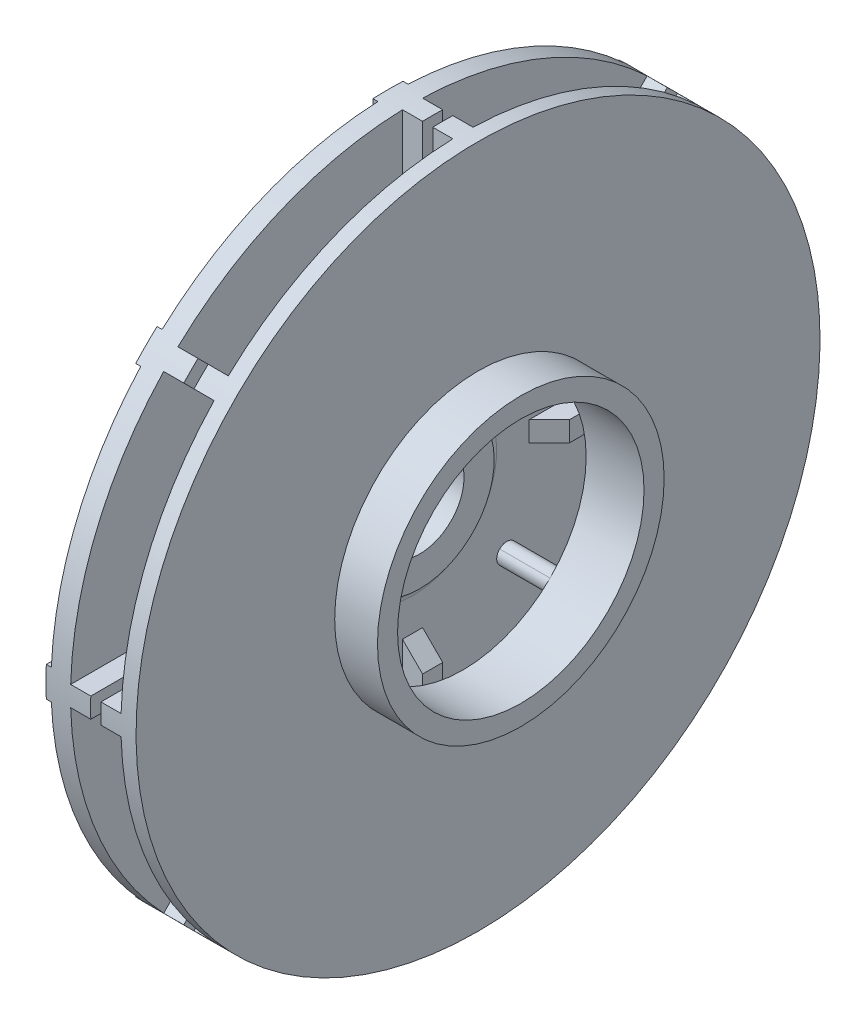
from build123d import *

# Parameters (mm, degrees)
BOSS_EXTRUDE3_DEPTH      = 6.35
FILLET1_R                = 6.35
CIRPATTERN5_COUNT        = 4
FILLET1_OF_CIRPATTERN5_R = 6.35
BOSS_EXTRUDE4_DEPTH      = 6.35
CIRPATTERN4_COUNT        = 4
SKETCH6_R                = 234.193665804
SKETCH6_R_2              = 215.9
CUT_EXTRUDE1_DEPTH       = 350.00288517
FILLET2_R                = 0.635
SKETCH7_R                = 60.93897947
CUT_EXTRUDE2_DEPTH       = 4.953
SKETCH8_R                = 79.670197019
CUT_EXTRUDE3_DEPTH       = 18.9484
CUT_EXTRUDE4_START       = 20.32
SKETCH11_R               = 219.71
SKETCH11_R_2             = 50.8
CUT_EXTRUDE4_DEPTH       = 20.32
CUT_EXTRUDE10_REACH      = 337.887
SKETCH20_R               = 30.226
SKETCH20_R_2             = 26.8224
CUT_EXTRUDE11_DEPTH      = 2.0066
CUT_EXTRUDE13_DEPTH      = 3.175
CIRPATTERN6_COUNT        = 8
SKETCH24_W               = 27.0002
SKETCH24_H               = 10.092146942
SKETCH25_R               = 27.9527
CUT_EXTRUDE14_DEPTH      = 14.3002


with BuildPart() as part:
    # Sketch1 → Revolve2 (revolve)
    with BuildSketch(Plane.XY, mode=Mode.PRIVATE) as revolve2_sk:
        with BuildLine():
            Line((-140.081298787, 50.8), (-140.081298787, 0))
            Line((-140.081298787, 0), (-39.979898787, 0))
            Line((-39.979898787, 0), (-39.979898787, 46.736))
            Line((-39.979898787, 46.736), (-43.154898787, 46.736))
            ThreePointArc((-43.154898787, 46.736), (-47.645026847, 48.595871939), (-49.504898787, 53.086))
            Line((-49.504898787, 53.086), (-49.504898787, 219.71))
            Line((-49.504898787, 219.71), (-64.998898787, 219.71))
            Line((-64.998898787, 219.71), (-64.998898787, 63.5))
            ThreePointArc((-64.998898787, 63.5), (-68.718642666, 54.519743879), (-77.698898787, 50.8))
            Line((-77.698898787, 50.8), (-140.081298787, 50.8))
        make_face()
        with BuildLine():
            Line((-9.677698787, 219.71), (-17.678698787, 219.71))
            Line((-17.678698787, 219.71), (-17.678698787, 77.7875))
            Line((-17.678698787, 77.7875), (1.650701213, 77.7875))
            Line((1.650701213, 77.7875), (18.846501213, 77.7875))
            Line((18.846501213, 77.7875), (18.846501213, 93.599))
            ThreePointArc((18.846501213, 93.599), (18.400131948, 94.676630735), (17.322501213, 95.123))
            Line((17.322501213, 95.123), (-6.629698787, 95.123))
            ThreePointArc((-6.629698787, 95.123), (-7.707329521, 95.569369265), (-8.153698787, 96.647))
            Line((-8.153698787, 96.647), (-8.153698787, 218.186))
            ThreePointArc((-8.153698787, 218.186), (-8.600068052, 219.263630735), (-9.677698787, 219.71))
        make_face()
    revolve(revolve2_sk.sketch.rotate(Axis((-140.081298787, 0, 0), (1, 0, 0)), 180), axis=Axis((-140.081298787, 0, 0), (1, 0, 0)))

    # Sketch4 → Boss-Extrude3 (add, symmetric)
    with BuildSketch(Plane(origin=(0, 0, 0), x_dir=(1, 0, 0), z_dir=(0, -0.7071067811865488, 0.7071067811865464))):
        Polygon((-17.678698787, 219.71), (-30.378698787, 219.71), (-30.378698787, 130.302), (-36.804898787, 130.302), (-36.804898787, 219.71), (-49.504898787, 219.71), (-49.504898787, 77.7875), (-17.678698787, 77.7875), align=None)
    boss_extrude3 = extrude(amount=BOSS_EXTRUDE3_DEPTH, both=True)

    # Fillet1
    # the kernel refuses this fillet: 6.35 mm, written as the material it takes off along each edge
    with BuildSketch(Plane(origin=(-30.378698787, 87.647299742, 96.627555863), x_dir=(0, -0.7071067811865464, -0.7071067811865486), z_dir=(-1, 0, 0))) as fillet1_piece_1:
        with BuildLine():
            CenterArc((FILLET1_R, -FILLET1_R), FILLET1_R, 90, 90)
            Line((0, -FILLET1_R), (0, 0))
            Line((0, 0), (FILLET1_R, 0))
        make_face()
    extrude(amount=6.4262, mode=Mode.SUBTRACT)
    with BuildSketch(Plane(origin=(-30.378698787, 96.627555863, 87.647299742), x_dir=(0, -0.7071067811865464, -0.7071067811865486), z_dir=(-1, 0, 0))) as fillet1_piece_2:
        with BuildLine():
            CenterArc((FILLET1_R, FILLET1_R), FILLET1_R, 180, 90)
            Line((0, FILLET1_R), (0, 0))
            Line((0, 0), (FILLET1_R, 0))
        make_face()
    extrude(amount=6.4262, mode=Mode.SUBTRACT)
    with BuildSketch(Plane(origin=(-49.504898787, 59.494196802, 50.513940681), x_dir=(0, 0.707106781186547, 0.7071067811865481), z_dir=(1, 0, 0)), Plane(origin=(-49.504898787, 50.513940681, 59.494196802), x_dir=(0, 0.7071067811865492, -0.7071067811865459), z_dir=(1, 0, 0))) as fillet1_piece_3:
        with BuildLine():
            CenterArc((FILLET1_R, FILLET1_R), FILLET1_R, 180, 90)
            Line((0, FILLET1_R), (0, 0))
            Line((0, 0), (FILLET1_R, 0))
        make_face()
    extrude(amount=31.8262, mode=Mode.SUBTRACT)

    # CirPattern5: Boss-Extrude3 ×4 about axis
    cirpattern5_axis = Axis((0, 0, 0), (1, 0, 0))
    for i in range(1, CIRPATTERN5_COUNT):
        add(boss_extrude3.rotate(cirpattern5_axis, i * 360 / CIRPATTERN5_COUNT))

    # Fillet1 of CirPattern5
    # the kernel refuses this fillet: 6.35 mm, written as the material it takes off along each edge
    with BuildSketch(Plane(origin=(-30.378698787, -96.627555863, 87.647299742), x_dir=(0, 0.7071067811865509, -0.7071067811865441), z_dir=(-1, 0, 0)), Plane(origin=(-30.378698787, -87.647299742, -96.627555863), x_dir=(0, 0.7071067811865452, 0.7071067811865498), z_dir=(-1, 0, 0)), Plane(origin=(-30.378698787, 96.627555863, -87.647299742), x_dir=(0, -0.7071067811865498, 0.7071067811865454), z_dir=(-1, 0, 0))) as fillet1_of_cirpattern5_piece_1:
        with BuildLine():
            CenterArc((FILLET1_OF_CIRPATTERN5_R, -FILLET1_OF_CIRPATTERN5_R), FILLET1_OF_CIRPATTERN5_R, 90, 90)
            Line((0, -FILLET1_OF_CIRPATTERN5_R), (0, 0))
            Line((0, 0), (FILLET1_OF_CIRPATTERN5_R, 0))
        make_face()
    extrude(amount=6.4262, mode=Mode.SUBTRACT)
    with BuildSketch(Plane(origin=(-30.378698787, -87.647299742, 96.627555863), x_dir=(0, 0.7071067811865509, -0.7071067811865441), z_dir=(-1, 0, 0)), Plane(origin=(-30.378698787, -96.627555863, -87.647299742), x_dir=(0, 0.7071067811865441, 0.7071067811865509), z_dir=(-1, 0, 0)), Plane(origin=(-30.378698787, 87.647299742, -96.627555863), x_dir=(0, -0.7071067811865509, 0.7071067811865441), z_dir=(-1, 0, 0))) as fillet1_of_cirpattern5_piece_2:
        with BuildLine():
            CenterArc((FILLET1_OF_CIRPATTERN5_R, FILLET1_OF_CIRPATTERN5_R), FILLET1_OF_CIRPATTERN5_R, 180, 90)
            Line((0, FILLET1_OF_CIRPATTERN5_R), (0, 0))
            Line((0, 0), (FILLET1_OF_CIRPATTERN5_R, 0))
        make_face()
    extrude(amount=6.4262, mode=Mode.SUBTRACT)
    with BuildSketch(Plane(origin=(-49.504898787, -50.513940681, 59.494196802), x_dir=(0, -0.7071067811865475, 0.7071067811865475), z_dir=(1, 0, 0)), Plane(origin=(-49.504898787, -59.494196802, 50.513940681), x_dir=(0, 0.7071067811865464, 0.7071067811865486), z_dir=(1, 0, 0)), Plane(origin=(-49.504898787, -59.494196802, -50.513940681), x_dir=(0, -0.7071067811865481, -0.707106781186547), z_dir=(1, 0, 0)), Plane(origin=(-49.504898787, -50.513940681, -59.494196802), x_dir=(0, -0.7071067811865486, 0.7071067811865464), z_dir=(1, 0, 0)), Plane(origin=(-49.504898787, 50.513940681, -59.494196802), x_dir=(0, 0.7071067811865476, -0.7071067811865476), z_dir=(1, 0, 0)), Plane(origin=(-49.504898787, 59.494196802, -50.513940681), x_dir=(0, -0.7071067811865459, -0.7071067811865492), z_dir=(1, 0, 0))) as fillet1_of_cirpattern5_piece_3:
        with BuildLine():
            CenterArc((FILLET1_OF_CIRPATTERN5_R, FILLET1_OF_CIRPATTERN5_R), FILLET1_OF_CIRPATTERN5_R, 180, 90)
            Line((0, FILLET1_OF_CIRPATTERN5_R), (0, 0))
            Line((0, 0), (FILLET1_OF_CIRPATTERN5_R, 0))
        make_face()
    extrude(amount=31.8262, mode=Mode.SUBTRACT)

    # Sketch5 → Boss-Extrude4 (add, symmetric)
    with BuildSketch(Plane(origin=(0, 0, 0), x_dir=(-1, 0, 0), z_dir=(0, 0, -1))):
        Polygon((49.504898787, 219.71), (49.504898787, 73.66), (36.804898787, 86.36), (36.804898787, 219.71), align=None)
        Polygon((17.678698787, 77.7875), (17.678698787, 219.71), (30.378698787, 219.71), (30.378698787, 90.4875), align=None)
    boss_extrude4 = extrude(amount=BOSS_EXTRUDE4_DEPTH, both=True)

    # CirPattern4: Boss-Extrude4 ×4 about axis
    cirpattern4_axis = Axis((0, 0, 0), (1, 0, 0))
    for i in range(1, CIRPATTERN4_COUNT):
        add(boss_extrude4.rotate(cirpattern4_axis, i * 360 / CIRPATTERN4_COUNT))

    # Sketch6 → Cut-Extrude1 (cut, through all)
    with BuildSketch(Plane.ZY.offset(140.081298787)):
        Circle(SKETCH6_R)
        with Locations(Location((0, 0, 0), (0, 0, 270))):
            Circle(SKETCH6_R_2, mode=Mode.SUBTRACT)
    extrude(amount=-CUT_EXTRUDE1_DEPTH, mode=Mode.SUBTRACT)

    # Fillet2
    fillet2_edges = [part.edges().sort_by_distance(p)[0] for p in [
        (-39.979898787, 46.736, 0),
    ]]
    fillet(fillet2_edges, radius=FILLET2_R)

    # Sketch7 → Cut-Extrude2 (cut)
    with BuildSketch(Plane(origin=(-39.979898787, 0, 0), x_dir=(0, 0, -1), z_dir=(1, 0, 0))):
        Circle(SKETCH7_R)
    extrude(amount=-CUT_EXTRUDE2_DEPTH, mode=Mode.SUBTRACT)

    # Sketch8 → Cut-Extrude3 (cut)
    with BuildSketch(Plane.ZY.offset(140.081298787)):
        Circle(SKETCH8_R)
    extrude(amount=-CUT_EXTRUDE3_DEPTH, mode=Mode.SUBTRACT)

    # Sketch11 → Cut-Extrude4 (cut)
    with BuildSketch(Plane.ZY.offset(64.998898787).offset(CUT_EXTRUDE4_START)):
        Circle(SKETCH11_R)
        with Locations(Location((0, 0, 0), (0, 0, 270))):
            Circle(SKETCH11_R_2, mode=Mode.SUBTRACT)
    extrude(amount=-CUT_EXTRUDE4_DEPTH, mode=Mode.SUBTRACT)

    # Sketch12 → Cut-Revolve1 (revolve, cut)
    with BuildSketch(Plane(origin=(0, 0, 0), x_dir=(1, 0, 0), z_dir=(0, 1, 0)), mode=Mode.PRIVATE) as cut_revolve1_sk:
        with BuildLine():
            Line((-121.132898787, 31.75), (-80.111898787, 31.75))
            ThreePointArc((-80.111898787, 31.75), (-76.957987839, 32.588616713), (-74.637123327, 34.882961973))
            Line((-74.637123327, 34.882961973), (-65.874123327, 49.795890249))
            ThreePointArc((-65.874123327, 49.795890249), (-65.613530636, 50.287482958), (-65.396970658, 50.8))
            Line((-65.396970658, 50.8), (-121.132898787, 50.8))
            Line((-121.132898787, 50.8), (-121.132898787, 31.75))
        make_face()
    revolve(cut_revolve1_sk.sketch.rotate(Axis((-60.172898787, 0, 0), (-1, 0, 0)), 270), axis=Axis((-60.172898787, 0, 0), (-1, 0, 0)), mode=Mode.SUBTRACT)

    # Sketch18 → Cut-Extrude10 (cut, up to next)
    with BuildSketch(Plane.ZY.offset(121.132898787), mode=Mode.PRIVATE) as cut_extrude10_sk1:
        with BuildLine():
            Line((-14.359429538, -21.094621628), (-21.094621628, -14.359429538))
            Line((-21.094621628, -14.359429538), (-17.575856913, -10.840664823))
            ThreePointArc((-17.575856913, -10.840664823), (14.601896453, 14.601896453), (-10.840664823, -17.575856913))
            Line((-10.840664823, -17.575856913), (-14.359429538, -21.094621628))
        make_face()
    cut_extrude10_tool1 = extrude(cut_extrude10_sk1.sketch, amount=-CUT_EXTRUDE10_REACH, mode=Mode.PRIVATE) & part.part
    add(cut_extrude10_tool1.solids().sort_by_distance((-121.132899, -0.51024, -0.51024))[0], mode=Mode.SUBTRACT)

    # Sketch20 → Cut-Extrude11 (cut)
    with BuildSketch(Plane.ZY.offset(121.132898787)):
        with Locations(Location((0, 0, 0), (0, 0, 270))):
            Circle(SKETCH20_R)
        with Locations(Location((0, 0, 0), (0, 0, 270))):
            Circle(SKETCH20_R_2, mode=Mode.SUBTRACT)
    extrude(amount=-CUT_EXTRUDE11_DEPTH, mode=Mode.SUBTRACT)

    # Sketch22 → Cut-Extrude13 (cut)
    with BuildSketch(Plane.ZY.offset(64.998898787)):
        with BuildLine():
            Line((50.92871008, 64.399094261), (145.78051919, 159.250903372))
            ThreePointArc((145.78051919, 159.250903372), (82.621353048, 199.465591069), (9.525, 215.689787368))
            Line((9.525, 215.689787368), (9.525, 84.123223233))
            ThreePointArc((9.525, 84.123223233), (24.00104092, 61.192302667), (50.92871008, 64.399094261))
        make_face()
    cut_extrude13 = extrude(amount=-CUT_EXTRUDE13_DEPTH, mode=Mode.SUBTRACT)

    # CirPattern6: Cut-Extrude13 ×8 about axis
    cirpattern6_axis = Axis((0, 0, 0), (1, 0, 0))
    for i in range(1, CIRPATTERN6_COUNT):
        add(cut_extrude13.rotate(cirpattern6_axis, i * 360 / CIRPATTERN6_COUNT), mode=Mode.SUBTRACT)

    # Sketch24 → Cut-Revolve2 (revolve, cut)
    with BuildSketch(Plane(origin=(0, 0, 0), x_dir=(1, 0, 0), z_dir=(0, 1, 0)), mode=Mode.PRIVATE) as cut_revolve2_sk:
        with Locations((5.346401213, 95.533573471)):
            Rectangle(SKETCH24_W, SKETCH24_H)
    revolve(cut_revolve2_sk.sketch.rotate(Axis((-154.951085714, 0, 0), (1, 0, 0)), 271.68541304), axis=Axis((-154.951085714, 0, 0), (1, 0, 0)), mode=Mode.SUBTRACT)

    # Sketch25 → Cut-Extrude14 (cut)
    with BuildSketch(Plane(origin=(-44.932898787, 0, 0), x_dir=(0, 0, -1), z_dir=(1, 0, 0))):
        with Locations(Location((0, 0, 0), (0, 0, 90))):
            Circle(SKETCH25_R)
    extrude(amount=-CUT_EXTRUDE14_DEPTH, mode=Mode.SUBTRACT)


solid = part.part
